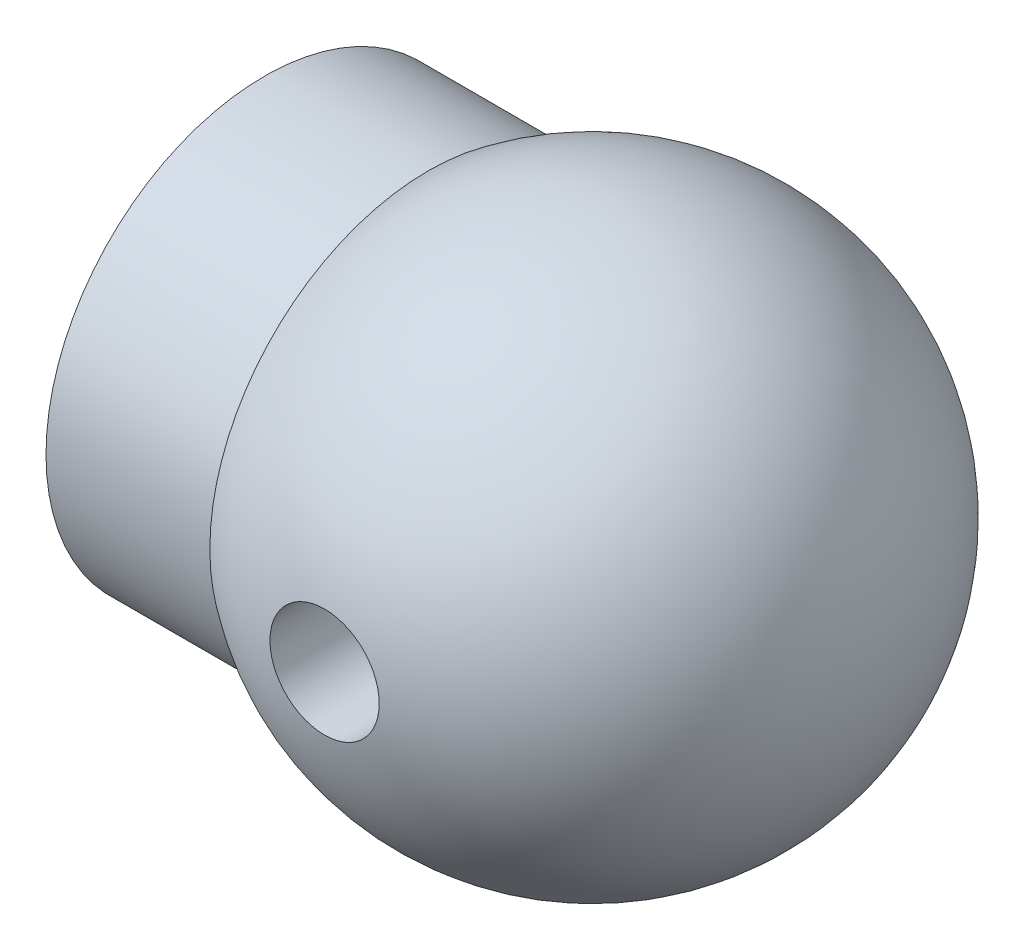
from build123d import *

# Parameters (mm, degrees)
CUT_EXTRUDE_1_DEPTH      = 66.383484153
CUT_EXTRUDE_1_DEPTH_BACK = 66.383484153
SKETCH_3_R               = 5


with BuildPart() as part:
    # 草图1 → 旋转1 (revolve)
    with BuildSketch(Plane.XY):
        with BuildLine():
            Line((0, 0), (0, 20))
            Line((0, 20), (15, 20))
            ThreePointArc((15, 20), (41.180339887, 22.360679775), (55, 0))
            Line((55, 0), (0, 0))
        make_face()
    revolve(axis=Axis((0, 0, 0), (1, 0, 0)))

    # 草图3 → 切除-拉伸1 (cut, two sides: drawn at the far end of the back side and taken through both)
    with BuildSketch(Plane.XY.offset(-CUT_EXTRUDE_1_DEPTH_BACK)):
        with Locations((30, 0)):
            Circle(SKETCH_3_R)
    extrude(amount=CUT_EXTRUDE_1_DEPTH + CUT_EXTRUDE_1_DEPTH_BACK, mode=Mode.SUBTRACT)


solid = part.part
